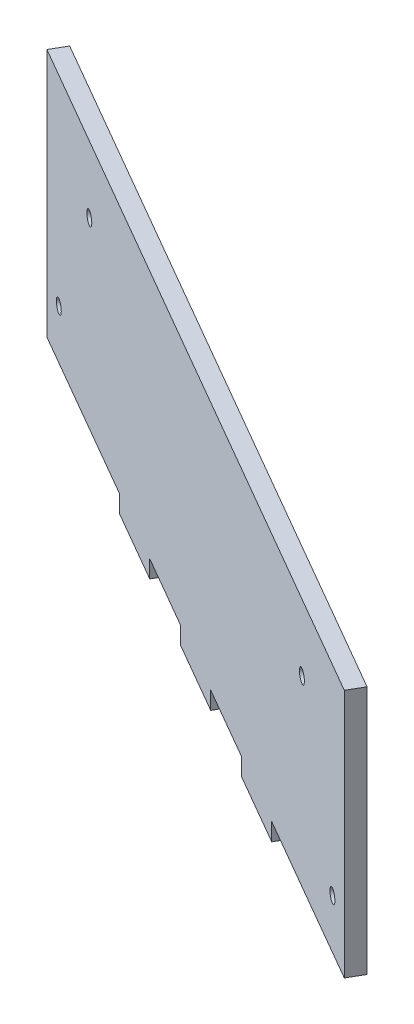
from build123d import *

# Parameters (mm, degrees)
STOCK_FRAME_MASTER_1_START     = 163.456714755
STOCK_FRAME_MASTER_1_OUTLINE_R = 2
STOCK_FRAME_MASTER_1_DEPTH     = 5


# Read off the part's stored shape, not the designer's step: Stock-frame-master-1
with BuildPart() as part:
    # Stock-frame-master-1 outline → Stock-frame-master-1 (new body)
    with BuildSketch(Plane(origin=(0, 0, 0), x_dir=(0.866025403784438, 0, 0.500000000000001), z_dir=(0.500000000000001, 0, -0.866025403784438)).offset(STOCK_FRAME_MASTER_1_START)):
        Polygon((0, 15), (121.884572681, 15), (121.884572681, 89.75), (62.4, 89.75), (62.4, 95), (37.6, 95), (37.6, 89.75), (12.4, 89.75), (12.4, 95), (0, 95), align=None)
        with Locations((87.134572681, 35)):
            Circle(STOCK_FRAME_MASTER_1_OUTLINE_R, mode=Mode.SUBTRACT)
        with Locations((112.134572681, 75)):
            Circle(STOCK_FRAME_MASTER_1_OUTLINE_R, mode=Mode.SUBTRACT)
    extrude(amount=STOCK_FRAME_MASTER_1_DEPTH)

    # Mirror1: part across plane


with BuildPart() as part_1:
    add(part.part)
    add(part.part.mirror(Plane(origin=(81.728357378, -89.75, -141.557667397), x_dir=(-0.5000000000000008, 0, 0.8660254037844382), z_dir=(-0.8660254037844383, 0, -0.5000000000000008))))


solid = part_1.part
